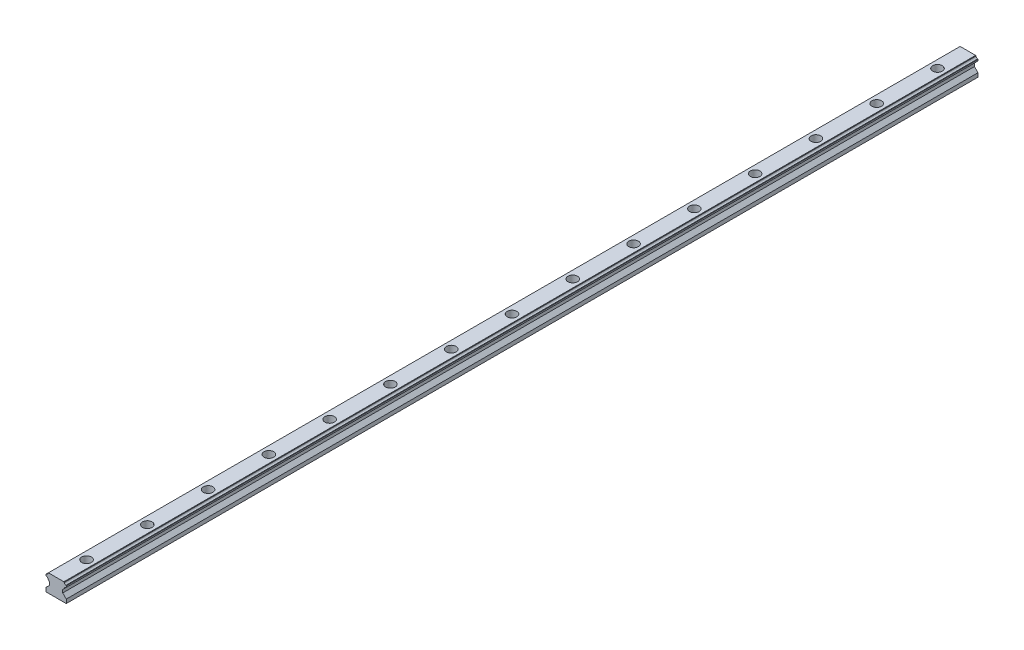
from build123d import *

# Parameters (mm, degrees)
BOSS_EXTRUDE1_DEPTH   = 450
SKETCH2_R             = 3
CUT_EXTRUDE1_DEPTH    = 451.451162725
SKETCH3_R             = 4.75
CUT_EXTRUDE2_DEPTH    = 8.5
LPATTERN1_COUNT       = 100
LPATTERN1_PITCH       = 60
MIRROR2_START         = -14.5
MIRROR2_OUTLINE_R     = 4.75
MIRROR2_DEPTH         = 17.5
MIRROR2_2_OUTLINE_W   = 3.5
MIRROR2_2_OUTLINE_H   = 450
MIRROR2_2_OUTLINE_R   = 4.75
MIRROR2_2_OUTLINE_R_2 = 3
MIRROR2_2_DEPTH       = 3.85
MIRROR2_START_2       = -0.65
MIRROR2_3_OUTLINE_W   = 3.5
MIRROR2_3_OUTLINE_H   = 450
MIRROR2_3_DEPTH       = 1.3
MIRROR2_START_3       = -11.024451
MIRROR2_4_OUTLINE_R   = 4.75
MIRROR2_4_OUTLINE_R_2 = 3
MIRROR2_4_DEPTH       = 5.524451
MIRROR2_START_4       = -450
MIRROR2_5_DEPTH       = 450


with BuildPart() as part:
    # Sketch1 → Boss-Extrude1 (new body)
    with BuildSketch(Plane.XY):
        with BuildLine():
            Line((-6.5, -4.15), (-6.5, -7.15))
            Line((-6.5, -7.15), (-10, -10.65))
            Line((-10, -10.65), (-10, -14.5))
            Line((-10, -14.5), (0, -14.5))
            Line((0, -14.5), (0, 3))
            Line((0, 3), (-7.65, 3))
            Line((-7.65, 3), (-8.003553391, 2.646446609))
            ThreePointArc((-8.003553391, 2.646446609), (-8.484745674, 1.484745674), (-9.646446609, 1.003553391))
            Line((-9.646446609, 1.003553391), (-10, 0.65))
            Line((-10, 0.65), (-10, -0.65))
            Line((-10, -0.65), (-9.646446609, -1.003553391))
            ThreePointArc((-9.646446609, -1.003553391), (-8.484745674, -1.484745674), (-8.003553391, -2.646446609))
            Line((-8.003553391, -2.646446609), (-6.5, -4.15))
        make_face()
    boss_extrude1 = extrude(amount=BOSS_EXTRUDE1_DEPTH)

    # Mirror1: Boss-Extrude1 across plane
    add(boss_extrude1.mirror(Plane(origin=(0, 3, 450), x_dir=(0, 0, 1), z_dir=(-1, 0, 0))))

    # Sketch2 → Cut-Extrude1 (cut, through all)
    with BuildSketch(Plane(origin=(0, 3, 0), x_dir=(1, 0, 0), z_dir=(0, 1, 0))):
        Circle(SKETCH2_R)
    cut_extrude1 = extrude(amount=-CUT_EXTRUDE1_DEPTH, mode=Mode.SUBTRACT)

    # Sketch3 → Cut-Extrude2 (cut)
    with BuildSketch(Plane(origin=(0, 3, 0), x_dir=(1, 0, 0), z_dir=(0, 1, 0))):
        Circle(SKETCH3_R)
    cut_extrude2 = extrude(amount=-CUT_EXTRUDE2_DEPTH, mode=Mode.SUBTRACT)

    # LPattern1: Cut-Extrude1, Cut-Extrude2 ×100
    with Locations(*[(0, 0, i * LPATTERN1_PITCH) for i in range(1, LPATTERN1_COUNT)]):
        add(cut_extrude1, mode=Mode.SUBTRACT)
        add(cut_extrude2, mode=Mode.SUBTRACT)

    # Mirror2: read off the stored shape, not the designer's step
    # Mirror2 outline → Mirror2 (add)
    with BuildSketch(Plane(origin=(0, 0, 0), x_dir=(1, 0, 0), z_dir=(0, 1, 0)).offset(MIRROR2_START)):
        with BuildLine():
            ThreePointArc((-4.75, 0), (0, 4.75), (4.75, 0))
            Line((4.75, 0), (6.5, 0))
            Line((6.5, 0), (6.5, 450))
            Line((6.5, 450), (-6.5, 450))
            Line((-6.5, 450), (-6.5, 0))
            Line((-6.5, 0), (-4.75, 0))
        make_face()
        with Locations((0, 60)):
            Circle(MIRROR2_OUTLINE_R, mode=Mode.SUBTRACT)
        with Locations((0, 120)):
            Circle(MIRROR2_OUTLINE_R, mode=Mode.SUBTRACT)
        with Locations((0, 180)):
            Circle(MIRROR2_OUTLINE_R, mode=Mode.SUBTRACT)
        with Locations((0, 240)):
            Circle(MIRROR2_OUTLINE_R, mode=Mode.SUBTRACT)
        with Locations((0, 300)):
            Circle(MIRROR2_OUTLINE_R, mode=Mode.SUBTRACT)
        with Locations((0, 360)):
            Circle(MIRROR2_OUTLINE_R, mode=Mode.SUBTRACT)
        with Locations((0, 420)):
            Circle(MIRROR2_OUTLINE_R, mode=Mode.SUBTRACT)
    extrude(amount=MIRROR2_DEPTH)

    # Mirror2 2 outline → Mirror2 2 (add)
    # profile 1 of 10: a face of its own
    with BuildSketch(Plane(origin=(0, 0, 0), x_dir=(1, 0, 0), z_dir=(0, 1, 0)).offset(MIRROR2_START)):
        with BuildLine():
            ThreePointArc((-3, 0), (0, 3), (3, 0))
            Line((3, 0), (4.75, 0))
            ThreePointArc((4.75, 0), (0, 4.75), (-4.75, 0))
            Line((-4.75, 0), (-3, 0))
        make_face()
    # profile 2 of 10: a face of its own
    with BuildSketch(Plane(origin=(0, 0, 0), x_dir=(1, 0, 0), z_dir=(0, 1, 0)).offset(MIRROR2_START)):
        with Locations((8.25, 225)):
            Rectangle(MIRROR2_2_OUTLINE_W, MIRROR2_2_OUTLINE_H)
    # profile 3 of 10: a face of its own
    with BuildSketch(Plane(origin=(0, 0, 0), x_dir=(1, 0, 0), z_dir=(0, 1, 0)).offset(MIRROR2_START)):
        with Locations((-8.25, 225)):
            Rectangle(MIRROR2_2_OUTLINE_W, MIRROR2_2_OUTLINE_H)
    # profile 4 of 10: a face of its own
    with BuildSketch(Plane(origin=(0, 0, 0), x_dir=(1, 0, 0), z_dir=(0, 1, 0)).offset(MIRROR2_START)):
        with Locations((0, 60)):
            Circle(MIRROR2_2_OUTLINE_R)
        with Locations((0, 60)):
            Circle(MIRROR2_2_OUTLINE_R_2, mode=Mode.SUBTRACT)
    # profile 5 of 10: a face of its own
    with BuildSketch(Plane(origin=(0, 0, 0), x_dir=(1, 0, 0), z_dir=(0, 1, 0)).offset(MIRROR2_START)):
        with Locations((0, 120)):
            Circle(MIRROR2_2_OUTLINE_R)
        with Locations((0, 120)):
            Circle(MIRROR2_2_OUTLINE_R_2, mode=Mode.SUBTRACT)
    # profile 6 of 10: a face of its own
    with BuildSketch(Plane(origin=(0, 0, 0), x_dir=(1, 0, 0), z_dir=(0, 1, 0)).offset(MIRROR2_START)):
        with Locations((0, 180)):
            Circle(MIRROR2_2_OUTLINE_R)
        with Locations((0, 180)):
            Circle(MIRROR2_2_OUTLINE_R_2, mode=Mode.SUBTRACT)
    # profile 7 of 10: a face of its own
    with BuildSketch(Plane(origin=(0, 0, 0), x_dir=(1, 0, 0), z_dir=(0, 1, 0)).offset(MIRROR2_START)):
        with Locations((0, 240)):
            Circle(MIRROR2_2_OUTLINE_R)
        with Locations((0, 240)):
            Circle(MIRROR2_2_OUTLINE_R_2, mode=Mode.SUBTRACT)
    # profile 8 of 10: a face of its own
    with BuildSketch(Plane(origin=(0, 0, 0), x_dir=(1, 0, 0), z_dir=(0, 1, 0)).offset(MIRROR2_START)):
        with Locations((0, 300)):
            Circle(MIRROR2_2_OUTLINE_R)
        with Locations((0, 300)):
            Circle(MIRROR2_2_OUTLINE_R_2, mode=Mode.SUBTRACT)
    # profile 9 of 10: a face of its own
    with BuildSketch(Plane(origin=(0, 0, 0), x_dir=(1, 0, 0), z_dir=(0, 1, 0)).offset(MIRROR2_START)):
        with Locations((0, 360)):
            Circle(MIRROR2_2_OUTLINE_R)
        with Locations((0, 360)):
            Circle(MIRROR2_2_OUTLINE_R_2, mode=Mode.SUBTRACT)
    # profile 10 of 10: a face of its own
    with BuildSketch(Plane(origin=(0, 0, 0), x_dir=(1, 0, 0), z_dir=(0, 1, 0)).offset(MIRROR2_START)):
        with Locations((0, 420)):
            Circle(MIRROR2_2_OUTLINE_R)
        with Locations((0, 420)):
            Circle(MIRROR2_2_OUTLINE_R_2, mode=Mode.SUBTRACT)
    extrude(amount=MIRROR2_2_DEPTH)

    # Mirror2 3 outline → Mirror2 3 (add)
    with BuildSketch(Plane(origin=(0, 0, 0), x_dir=(1, 0, 0), z_dir=(0, 1, 0)).offset(MIRROR2_START_2)):
        with Locations((8.25, 225)):
            Rectangle(MIRROR2_3_OUTLINE_W, MIRROR2_3_OUTLINE_H)
        with Locations((-8.25, 225)):
            Rectangle(MIRROR2_3_OUTLINE_W, MIRROR2_3_OUTLINE_H)
    extrude(amount=MIRROR2_3_DEPTH)

    # Mirror2 4 outline → Mirror2 4 (add)
    # profile 1 of 8: a face of its own
    with BuildSketch(Plane(origin=(0, 0, 0), x_dir=(1, 0, 0), z_dir=(0, 1, 0)).offset(MIRROR2_START_3)):
        with BuildLine():
            ThreePointArc((-3, 0), (0, 3), (3, 0))
            Line((3, 0), (4.75, 0))
            ThreePointArc((4.75, 0), (0, 4.75), (-4.75, 0))
            Line((-4.75, 0), (-3, 0))
        make_face()
    # profile 2 of 8: a face of its own
    with BuildSketch(Plane(origin=(0, 0, 0), x_dir=(1, 0, 0), z_dir=(0, 1, 0)).offset(MIRROR2_START_3)):
        with Locations((0, 60)):
            Circle(MIRROR2_4_OUTLINE_R)
        with Locations((0, 60)):
            Circle(MIRROR2_4_OUTLINE_R_2, mode=Mode.SUBTRACT)
    # profile 3 of 8: a face of its own
    with BuildSketch(Plane(origin=(0, 0, 0), x_dir=(1, 0, 0), z_dir=(0, 1, 0)).offset(MIRROR2_START_3)):
        with Locations((0, 120)):
            Circle(MIRROR2_4_OUTLINE_R)
        with Locations((0, 120)):
            Circle(MIRROR2_4_OUTLINE_R_2, mode=Mode.SUBTRACT)
    # profile 4 of 8: a face of its own
    with BuildSketch(Plane(origin=(0, 0, 0), x_dir=(1, 0, 0), z_dir=(0, 1, 0)).offset(MIRROR2_START_3)):
        with Locations((0, 180)):
            Circle(MIRROR2_4_OUTLINE_R)
        with Locations((0, 180)):
            Circle(MIRROR2_4_OUTLINE_R_2, mode=Mode.SUBTRACT)
    # profile 5 of 8: a face of its own
    with BuildSketch(Plane(origin=(0, 0, 0), x_dir=(1, 0, 0), z_dir=(0, 1, 0)).offset(MIRROR2_START_3)):
        with Locations((0, 240)):
            Circle(MIRROR2_4_OUTLINE_R)
        with Locations((0, 240)):
            Circle(MIRROR2_4_OUTLINE_R_2, mode=Mode.SUBTRACT)
    # profile 6 of 8: a face of its own
    with BuildSketch(Plane(origin=(0, 0, 0), x_dir=(1, 0, 0), z_dir=(0, 1, 0)).offset(MIRROR2_START_3)):
        with Locations((0, 300)):
            Circle(MIRROR2_4_OUTLINE_R)
        with Locations((0, 300)):
            Circle(MIRROR2_4_OUTLINE_R_2, mode=Mode.SUBTRACT)
    # profile 7 of 8: a face of its own
    with BuildSketch(Plane(origin=(0, 0, 0), x_dir=(1, 0, 0), z_dir=(0, 1, 0)).offset(MIRROR2_START_3)):
        with Locations((0, 360)):
            Circle(MIRROR2_4_OUTLINE_R)
        with Locations((0, 360)):
            Circle(MIRROR2_4_OUTLINE_R_2, mode=Mode.SUBTRACT)
    # profile 8 of 8: a face of its own
    with BuildSketch(Plane(origin=(0, 0, 0), x_dir=(1, 0, 0), z_dir=(0, 1, 0)).offset(MIRROR2_START_3)):
        with Locations((0, 420)):
            Circle(MIRROR2_4_OUTLINE_R)
        with Locations((0, 420)):
            Circle(MIRROR2_4_OUTLINE_R_2, mode=Mode.SUBTRACT)
    extrude(amount=MIRROR2_4_DEPTH)

    # Mirror2 5 outline → Mirror2 5 (add)
    with BuildSketch(Plane.XY.offset(MIRROR2_START_4)):
        Polygon((-6.5, -10.65), (-6.5, -7.15), (-10, -10.65), align=None)
        with BuildLine():
            Line((-8.003553391, -2.646446609), (-6.5, -4.15))
            Line((-6.5, -4.15), (-6.5, -0.65))
            Line((-6.5, -0.65), (-10, -0.65))
            Line((-10, -0.65), (-9.646446609, -1.003553391))
            ThreePointArc((-9.646446609, -1.003553391), (-8.484745674, -1.484745674), (-8.003553391, -2.646446609))
        make_face()
        with BuildLine():
            Line((7.65, 3), (6.5, 3))
            Line((6.5, 3), (6.5, 0.65))
            Line((6.5, 0.65), (10, 0.65))
            Line((10, 0.65), (9.646446609, 1.003553391))
            ThreePointArc((9.646446609, 1.003553391), (8.484745674, 1.484745674), (8.003553391, 2.646446609))
            Line((8.003553391, 2.646446609), (7.65, 3))
        make_face()
        with BuildLine():
            Line((-6.5, 3), (-7.65, 3))
            Line((-7.65, 3), (-8.003553391, 2.646446609))
            ThreePointArc((-8.003553391, 2.646446609), (-8.484745674, 1.484745674), (-9.646446609, 1.003553391))
            Line((-9.646446609, 1.003553391), (-10, 0.65))
            Line((-10, 0.65), (-6.5, 0.65))
            Line((-6.5, 0.65), (-6.5, 3))
        make_face()
        with BuildLine():
            Line((6.5, -0.65), (6.5, -4.15))
            Line((6.5, -4.15), (8.003553391, -2.646446609))
            ThreePointArc((8.003553391, -2.646446609), (8.484745674, -1.484745674), (9.646446609, -1.003553391))
            Line((9.646446609, -1.003553391), (10, -0.65))
            Line((10, -0.65), (6.5, -0.65))
        make_face()
        Polygon((10, -10.65), (6.5, -7.15), (6.5, -10.65), align=None)
    extrude(amount=MIRROR2_5_DEPTH)


solid = part.part
